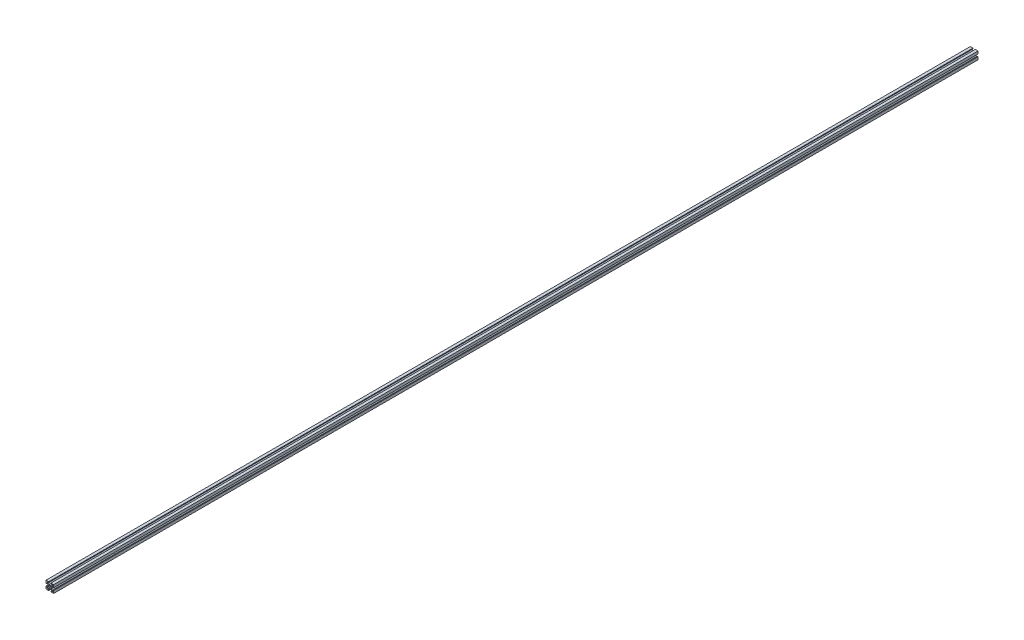
from build123d import *

# Parameters (mm, degrees)
ESQUISSE2_R          = 1.25
MAIN_EXTRUSION_DEPTH = 1200


with BuildPart() as part:
    # Esquisse2 → Main Extrusion (new body)
    with BuildSketch(Plane.XY):
        Polygon((-1, -2), (1, -2), (3.383507185, -4), (1.5, -4), (1.5, -5), (5, -5), (5, -1.5), (4, -1.5), (4, -3.383507185), (2, -1), (2, 1), (4, 3.383507185), (4, 1.5), (5, 1.5), (5, 5), (1.5, 5), (1.5, 4), (3.383507185, 4), (1, 2), (-1, 2), (-3.383507185, 4), (-1.5, 4), (-1.5, 5), (-5, 5), (-5, 1.5), (-4, 1.5), (-4, 3.383507185), (-2, 1), (-2, -1), (-4, -3.383507185), (-4, -1.5), (-5, -1.5), (-5, -5), (-1.5, -5), (-1.5, -4), (-3.383507185, -4), align=None)
        Circle(ESQUISSE2_R, mode=Mode.SUBTRACT)
    extrude(amount=MAIN_EXTRUSION_DEPTH)


solid = part.part
